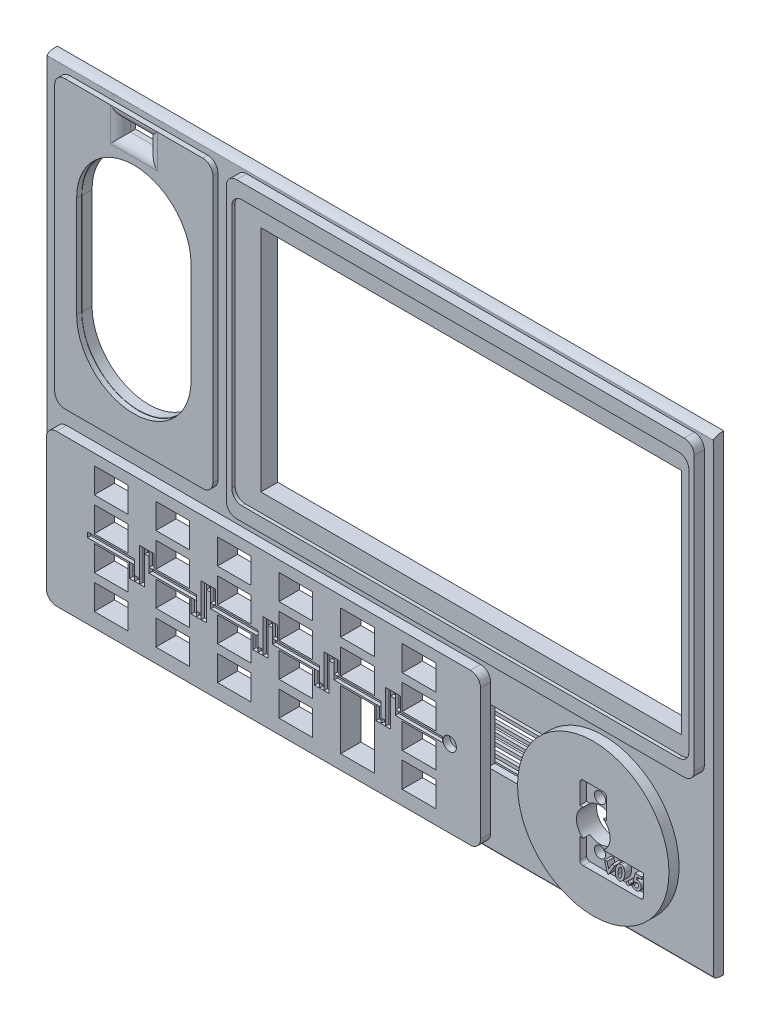
from build123d import *

# Parameters (mm, degrees)
SKETCH1_W                   = 198
SKETCH1_H                   = 140
MAIN_BODY_DEPTH             = 3
LONG_CORNERS_SIZE           = 3
LONG_CORNERS_SIZE_2         = 1
SKETCH2_W                   = 47
SKETCH2_H                   = 85
SPEAKER_DEPTH               = 1.5
SPEAKER_CORNERS_R           = 3
SPEAKER_CUT_DEPTH           = 122.331158548
SKETCH21_W                  = 43
SKETCH21_H                  = 72
SPEAKER_SLOT_DEPTH          = 3
SKETCH36_W                  = 43
SKETCH36_H                  = 0.5
SKETCH36_W_2                = 5.5
SKETCH36_W_3                = 3.5
SKETCH36_W_4                = 10
SPEAKER_PRINT_SUPPORT_DEPTH = 3
SKETCH3_W                   = 139
SKETCH3_H                   = 87.25
LCD_DEPTH                   = 3
LCD_CORNERS_R               = 3
SKETCH9_W                   = 135.8
SKETCH9_H                   = 78.75
LCD_FRONT_DEPTH             = 1
LCD_FRONT_CORNERS_R         = 3
SKETCH10_W                  = 125
SKETCH10_H                  = 68
LCD_BACK_DEPTH              = 122.396046203
SKETCH4_W                   = 129
SKETCH4_H                   = 45
KEYPAD_DEPTH                = 3
KEYPAD_CORNERS_R            = 3
SKETCH25_W                  = 10
SKETCH25_H                  = 7.5
SKETCH25_H_2                = 17.5
KEYPAD_CUTS_0_8_DEPTH       = 122.396046208
SKETCH5_R                   = 22.5
VFO_DEPTH                   = 3
SKETCH7_R                   = 5
VFO_ENCODER_KNOB_CUT_DEPTH  = 122.396046208
SKETCH37_W                  = 19
SKETCH37_H                  = 7
SKETCH37_W_2                = 8
LOGO_CUT_DEPTH              = 2
LOGO_TXT_VER_DEPTH          = 2
LOGO_CORNERS_R              = 1
ESP32_W                     = 18.5
ESP32_H                     = 16.5
ESP32_CAN_CUT_DEPTH         = 3
SKETCH43_W                  = 16.5
SKETCH43_H                  = 16.5
LORA_CUT_DEPTH              = 2.5
SKETCH44_R                  = 1.65
ENCODER_MOUNT_HOLES_DEPTH   = 122.396046208
SKETCH47_W                  = 27
SKETCH47_H                  = 18.5
ESP32_EX_CUT_DEPTH          = 1
SKETCH49_W                  = 8
SKETCH49_H                  = 4
AMB_SENSOR_DEPTH            = 122.396046208
AMB_CORNERS_R               = 3
SKETCH50_W                  = 14
SKETCH50_H                  = 1.5
SKETCH50_W_2                = 1.5
SKETCH50_H_2                = 4.24
SKETCH50_H_3                = 10
SKETCH50_W_3                = 1.3
SKETCH50_W_4                = 1.45
SKETCH50_W_5                = 1.26
SKETCH50_W_6                = 1.46
LORA_ANT_DEPTH              = 1
SKETCH51_R                  = 0.5
LORA_ANT_PIN_DEPTH          = 122.396046208
SKETCH52_R                  = 2
LORA_ANT_SOLDER_DEPTH       = 2
SKETCH53_W                  = 26.5
SKETCH53_H                  = 1
ESP32_SUPPORT_DEPTH         = 1
SKETCH54_W                  = 15.995889497
SKETCH54_H                  = 0.898645477
SKETCH54_H_2                = 1.168239121
SKETCH54_H_3                = 1.033442299
SKETCH54_W_2                = 15.726295854
SKETCH54_H_4                = 1.078374573
SKETCH54_H_5                = 0.943577751
BOSS_EXTRUDE2_DEPTH         = 2.5


# Some blends are built 0.0001 mm under size
with BuildPart() as part:
    # Sketch1 → main_body (new body)
    with BuildSketch(Plane.XY):
        Rectangle(SKETCH1_W, SKETCH1_H)
    extrude(amount=MAIN_BODY_DEPTH)

    # long_corners
    # an asymmetric fillet: 3, 1 mm, written as the material it takes off along each edge
    with BuildSketch(Plane(origin=(-106.5, 70, 3), x_dir=(0, 0, -1), z_dir=(1, 0, 0)), Plane(origin=(106.5, -70, 3), x_dir=(0, 0, -1), z_dir=(-1, 0, 0))) as long_corners_piece_1:
        with BuildLine():
            Bezier((LONG_CORNERS_SIZE, 0), (0, 0), (0, -LONG_CORNERS_SIZE_2), weights=[1, 0.707106781, 1])
            Line((0, -LONG_CORNERS_SIZE_2), (0, 0))
            Line((0, 0), (LONG_CORNERS_SIZE, 0))
        make_face()
    extrude(amount=213, mode=Mode.SUBTRACT)

    # Sketch2 → speaker (add)
    with BuildSketch(Plane.XY.offset(3)):
        with Locations((-71.75, 24.75)):
            Rectangle(SKETCH2_W, SKETCH2_H)
    extrude(amount=SPEAKER_DEPTH)

    # speaker_corners
    speaker_corners_edges = [part.edges().sort_by_distance(p)[0] for p in [
        (-95.25, 67.25, 3.75),
        (-95.25, -17.75, 3.75),
        (-48.25, -17.75, 3.75),
        (-48.25, 67.25, 3.75),
    ]]
    fillet(speaker_corners_edges, radius=SPEAKER_CORNERS_R)

    # Sketch19 → speaker_cut (cut, through all)
    with BuildSketch(Plane.XY.offset(4.5)):
        with BuildLine():
            Line((-88.75, 8.25), (-88.75, 38.25))
            ThreePointArc((-88.75, 38.25), (-71.75, 55.25), (-54.75, 38.25))
            Line((-54.75, 38.25), (-54.75, 8.25))
            ThreePointArc((-54.75, 8.25), (-71.75, -8.75), (-88.75, 8.25))
        make_face()
    extrude(amount=-SPEAKER_CUT_DEPTH, mode=Mode.SUBTRACT)

    # Sketch21 → speaker_slot (cut)
    with BuildSketch(Plane(origin=(0, 0, 0), x_dir=(-1, 0, 0), z_dir=(0, 0, -1))):
        with Locations((71.75, 23.25)):
            Rectangle(SKETCH21_W, SKETCH21_H)
    extrude(amount=-SPEAKER_SLOT_DEPTH, mode=Mode.SUBTRACT)

    # Sketch36 → speaker_print_support (add)
    # profile 1 of 17: a face of its own
    with BuildSketch(Plane(origin=(0, 0, 3), x_dir=(-1, 0, 0), z_dir=(0, 0, -1))):
        with BuildLine():
            Line((54.25, 8.263862744), (54.25, 38.236137256))
            ThreePointArc((54.25, 38.236137256), (71.75, 55.736137256), (89.25, 38.236137256))
            Line((89.25, 38.236137256), (89.25, 8.263862744))
            ThreePointArc((89.25, 8.263862744), (71.75, -9.236137256), (54.25, 8.263862744))
        make_face()
        with BuildLine():
            Line((54.831583339, 8.263862744), (54.831583339, 38.236137256))
            ThreePointArc((54.831583339, 38.236137256), (71.75, 55.154553916), (88.668416661, 38.236137256))
            Line((88.668416661, 38.236137256), (88.668416661, 8.263862744))
            ThreePointArc((88.668416661, 8.263862744), (71.75, -8.654553916), (54.831583339, 8.263862744))
        make_face(mode=Mode.SUBTRACT)
    # profile 2 of 17: a face of its own
    with BuildSketch(Plane(origin=(0, 0, 3), x_dir=(-1, 0, 0), z_dir=(0, 0, -1))):
        with Locations((71.75, 57)):
            Rectangle(SKETCH36_W, SKETCH36_H)
    # profile 3 of 17: a face of its own
    with BuildSketch(Plane(origin=(0, 0, 3), x_dir=(-1, 0, 0), z_dir=(0, 0, -1))):
        with Locations((90.5, 0)):
            Rectangle(SKETCH36_W_2, SKETCH36_H)
    # profile 4 of 17: a face of its own
    with BuildSketch(Plane(origin=(0, 0, 3), x_dir=(-1, 0, 0), z_dir=(0, 0, -1))):
        with Locations((71.75, -10.5)):
            Rectangle(SKETCH36_W, SKETCH36_H)
    # profile 5 of 17: a face of its own
    with BuildSketch(Plane(origin=(0, 0, 3), x_dir=(-1, 0, 0), z_dir=(0, 0, -1))):
        with Locations((90.5, 46.5)):
            Rectangle(SKETCH36_W_2, SKETCH36_H)
    # profile 6 of 17: a face of its own
    with BuildSketch(Plane(origin=(0, 0, 3), x_dir=(-1, 0, 0), z_dir=(0, 0, -1))):
        with Locations((91.5, 35)):
            Rectangle(SKETCH36_W_3, SKETCH36_H)
    # profile 7 of 17: a face of its own
    with BuildSketch(Plane(origin=(0, 0, 3), x_dir=(-1, 0, 0), z_dir=(0, 0, -1))):
        with Locations((91.5, 23.5)):
            Rectangle(SKETCH36_W_3, SKETCH36_H)
    # profile 8 of 17: a face of its own
    with BuildSketch(Plane(origin=(0, 0, 3), x_dir=(-1, 0, 0), z_dir=(0, 0, -1))):
        with Locations((91.5, 11)):
            Rectangle(SKETCH36_W_3, SKETCH36_H)
    # profile 9 of 17: a face of its own
    with BuildSketch(Plane(origin=(0, 0, 3), x_dir=(-1, 0, 0), z_dir=(0, 0, -1))):
        with Locations((88.25, -5.5)):
            Rectangle(SKETCH36_W_4, SKETCH36_H)
    # profile 10 of 17: a face of its own
    with BuildSketch(Plane(origin=(0, 0, 3), x_dir=(-1, 0, 0), z_dir=(0, 0, -1))):
        with Locations((88.25, 52)):
            Rectangle(SKETCH36_W_4, SKETCH36_H)
    # profile 11 of 17: a face of its own
    with BuildSketch(Plane(origin=(0, 0, 3), x_dir=(-1, 0, 0), z_dir=(0, 0, -1))):
        with Locations((55.25, 52)):
            Rectangle(SKETCH36_W_4, SKETCH36_H)
    # profile 12 of 17: a face of its own
    with BuildSketch(Plane(origin=(0, 0, 3), x_dir=(-1, 0, 0), z_dir=(0, 0, -1))):
        with Locations((53, 46.5)):
            Rectangle(SKETCH36_W_2, SKETCH36_H)
    # profile 13 of 17: a face of its own
    with BuildSketch(Plane(origin=(0, 0, 3), x_dir=(-1, 0, 0), z_dir=(0, 0, -1))):
        with Locations((52, 35)):
            Rectangle(SKETCH36_W_3, SKETCH36_H)
    # profile 14 of 17: a face of its own
    with BuildSketch(Plane(origin=(0, 0, 3), x_dir=(-1, 0, 0), z_dir=(0, 0, -1))):
        with Locations((52, 23.5)):
            Rectangle(SKETCH36_W_3, SKETCH36_H)
    # profile 15 of 17: a face of its own
    with BuildSketch(Plane(origin=(0, 0, 3), x_dir=(-1, 0, 0), z_dir=(0, 0, -1))):
        with Locations((52, 10.5)):
            Rectangle(SKETCH36_W_3, SKETCH36_H)
    # profile 16 of 17: a face of its own
    with BuildSketch(Plane(origin=(0, 0, 3), x_dir=(-1, 0, 0), z_dir=(0, 0, -1))):
        with Locations((53, 0)):
            Rectangle(SKETCH36_W_2, SKETCH36_H)
    # profile 17 of 17: a face of its own
    with BuildSketch(Plane(origin=(0, 0, 3), x_dir=(-1, 0, 0), z_dir=(0, 0, -1))):
        with Locations((55.25, -5.5)):
            Rectangle(SKETCH36_W_4, SKETCH36_H)
    extrude(amount=SPEAKER_PRINT_SUPPORT_DEPTH)

    # Sketch3 → lcd (add)
    with BuildSketch(Plane.XY.offset(3)):
        with Locations((26.75, 24.625)):
            Rectangle(SKETCH3_W, SKETCH3_H)
    extrude(amount=LCD_DEPTH)

    # lcd_corners
    lcd_corners_edges = [part.edges().sort_by_distance(p)[0] for p in [
        (-42.75, 68.25, 4.5),
        (-42.75, -19, 4.5),
        (96.25, -19, 4.5),
        (96.25, 68.25, 4.5),
    ]]
    fillet(lcd_corners_edges, radius=LCD_CORNERS_R)

    # Sketch9 → lcd_front (cut)
    with BuildSketch(Plane.XY.offset(6)):
        with Locations((26.75, 24.5)):
            Rectangle(SKETCH9_W, SKETCH9_H)
    extrude(amount=-LCD_FRONT_DEPTH, mode=Mode.SUBTRACT)

    # lcd_front_corners
    lcd_front_corners_edges = [part.edges().sort_by_distance(p)[0] for p in [
        (-41.15, -14.875, 5.5),
        (-41.15, 63.875, 5.5),
        (94.65, 63.875, 5.5),
        (94.65, -14.875, 5.5),
    ]]
    fillet(lcd_front_corners_edges, radius=LCD_FRONT_CORNERS_R)

    # Sketch10 → lcd_back (cut, through all)
    with BuildSketch(Plane(origin=(0, 0, 0), x_dir=(-1, 0, 0), z_dir=(0, 0, -1))):
        with Locations((-29, 24.5)):
            Rectangle(SKETCH10_W, SKETCH10_H)
    extrude(amount=-LCD_BACK_DEPTH, mode=Mode.SUBTRACT)

    # Sketch4 → keypad (add)
    with BuildSketch(Plane.XY.offset(3)):
        with Locations((-31.75, -45.75)):
            Rectangle(SKETCH4_W, SKETCH4_H)
    extrude(amount=KEYPAD_DEPTH)

    # keypad_corners
    keypad_corners_edges = [part.edges().sort_by_distance(p)[0] for p in [
        (-96.25, -23.25, 4.5),
        (-96.25, -68.25, 4.5),
        (32.75, -68.25, 4.5),
        (32.75, -23.25, 4.5),
    ]]
    fillet(keypad_corners_edges, radius=KEYPAD_CORNERS_R)

    # Sketch25 → keypad_cuts_0.8 (cut, through all)
    with BuildSketch(Plane.XY.offset(6)):
        with Locations((-77, -30.25)):
            Rectangle(SKETCH25_W, SKETCH25_H)
        with Locations((-77, -40.25)):
            Rectangle(SKETCH25_W, SKETCH25_H)
        with Locations((-77, -50.25)):
            Rectangle(SKETCH25_W, SKETCH25_H)
        with Locations((-77, -60.25)):
            Rectangle(SKETCH25_W, SKETCH25_H)
        with Locations((-58.7, -30.25)):
            Rectangle(SKETCH25_W, SKETCH25_H)
        with Locations((-58.7, -40.25)):
            Rectangle(SKETCH25_W, SKETCH25_H)
        with Locations((-58.7, -50.25)):
            Rectangle(SKETCH25_W, SKETCH25_H)
        with Locations((-58.7, -60.25)):
            Rectangle(SKETCH25_W, SKETCH25_H)
        with Locations((-40.4, -30.25)):
            Rectangle(SKETCH25_W, SKETCH25_H)
        with Locations((-40.4, -40.25)):
            Rectangle(SKETCH25_W, SKETCH25_H)
        with Locations((-40.4, -50.25)):
            Rectangle(SKETCH25_W, SKETCH25_H)
        with Locations((-40.4, -60.25)):
            Rectangle(SKETCH25_W, SKETCH25_H)
        with Locations((-22.1, -30.25)):
            Rectangle(SKETCH25_W, SKETCH25_H)
        with Locations((-22.1, -40.25)):
            Rectangle(SKETCH25_W, SKETCH25_H)
        with Locations((-22.1, -50.25)):
            Rectangle(SKETCH25_W, SKETCH25_H)
        with Locations((-22.1, -60.25)):
            Rectangle(SKETCH25_W, SKETCH25_H)
        with Locations((-3.8, -30.25)):
            Rectangle(SKETCH25_W, SKETCH25_H)
        with Locations((14.5, -30.25)):
            Rectangle(SKETCH25_W, SKETCH25_H)
        with Locations((-3.8, -40.25)):
            Rectangle(SKETCH25_W, SKETCH25_H)
        with Locations((14.5, -40.25)):
            Rectangle(SKETCH25_W, SKETCH25_H)
        with Locations((14.5, -50.25)):
            Rectangle(SKETCH25_W, SKETCH25_H)
        with Locations((14.5, -60.25)):
            Rectangle(SKETCH25_W, SKETCH25_H)
        with Locations((-3.8, -55.25)):
            Rectangle(SKETCH25_W, SKETCH25_H_2)
    extrude(amount=-KEYPAD_CUTS_0_8_DEPTH, mode=Mode.SUBTRACT)

    # Sketch5 → vfo (add)
    with BuildSketch(Plane.XY.offset(3)):
        with Locations((66.25, -45.75)):
            Circle(SKETCH5_R)
    extrude(amount=VFO_DEPTH)

    # Sketch7 → vfo_encoder_knob_cut (cut, through all)
    with BuildSketch(Plane.XY.offset(6)):
        with Locations((66.25, -45.75)):
            Circle(SKETCH7_R)
    extrude(amount=-VFO_ENCODER_KNOB_CUT_DEPTH, mode=Mode.SUBTRACT)

    # Sketch37 → logo_cut (cut)
    with BuildSketch(Plane.XY.offset(6)):
        with Locations((71.75, -53.25)):
            Rectangle(SKETCH37_W, SKETCH37_H)
        with Locations((66.25, -38.25)):
            Rectangle(SKETCH37_W_2, SKETCH37_H)
    extrude(amount=-LOGO_CUT_DEPTH, mode=Mode.SUBTRACT)

    # Sketch39 → logo_txt_ver (add)
    # profile 1 of 4: a face of its own
    with BuildSketch(Plane.XY.offset(4)):
        Polygon((69.593603098, -52.1228561), (70.325447382, -52.1228561), (70.816452991, -53.843495791), (71.823904915, -52.1228561), (72.632071314, -52.1228561), (70.821541132, -55.216445844), (70.476395566, -55.216445844), align=None)
    # profile 2 of 4: a face of its own
    with BuildSketch(Plane.XY.offset(4)):
        with BuildLine():
            add(Edge.make_bspline(
                [(74.483306624, -50.874565502), (74.52298082, -50.875795528), (74.601170322, -50.87821965), (74.715492643, -50.899653781), (74.825349181, -50.932120481), (74.92921693, -50.980946205), (75.029477781, -51.040750753), (75.122711711, -51.116943912), (75.212332831, -51.204521963), (75.296047107, -51.305539519), (75.372824655, -51.419248323), (75.438649142, -51.546769094), (75.49569148, -51.685939906), (75.540969256, -51.83776318), (75.576664195, -52.001610164), (75.60145224, -52.177923197), (75.616969224, -52.366525273), (75.618744605, -52.496237412), (75.61965812, -52.562980299)],
                knots=[0, 0, 0, 0, 0.836471817, 1.648510141, 2.446693269, 3.247435573, 4.063800371, 4.904091908, 5.781463953, 6.704836402, 7.667709944, 8.670923685, 9.727683881, 10.837250621, 12.009625467, 13.263198326, 14.591789123, 16, 16, 16, 16], degree=3))
            add(Edge.make_bspline(
                [(75.61965812, -52.562980299), (75.618789956, -52.632816793), (75.617076972, -52.770612041), (75.605096765, -52.974626446), (75.584904009, -53.17299239), (75.556211827, -53.365747486), (75.518683541, -53.552428277), (75.473940108, -53.733689305), (75.420453316, -53.909101426), (75.359593818, -54.077949378), (75.293364906, -54.237978695), (75.221962721, -54.387157738), (75.146403231, -54.524126464), (75.06893028, -54.650882727), (74.985482248, -54.764128364), (74.899617931, -54.866890365), (74.810118692, -54.958236021), (74.715135486, -55.036206727), (74.618399212, -55.10398037), (74.520168842, -55.163147091), (74.420182228, -55.213287094), (74.31810111, -55.254294613), (74.214386359, -55.285440783), (74.109326621, -55.308813247), (74.002290106, -55.32272783), (73.930152573, -55.324235706), (73.893930288, -55.324992853)],
                knots=[0, 0, 0, 0, 1.396844559, 2.756131219, 4.086127259, 5.383920942, 6.652453196, 7.89349539, 9.116895717, 10.318757433, 11.482194025, 12.579741648, 13.624829685, 14.610133714, 15.548779577, 16.435605836, 17.287197802, 18.102347136, 18.889788549, 19.648068299, 20.394000194, 21.124756219, 21.84557971, 22.557590164, 23.275725456, 24, 24, 24, 24], degree=3))
            add(Edge.make_bspline(
                [(73.893930288, -55.324992853), (73.843149178, -55.322924604), (73.743631944, -55.318871396), (73.598486378, -55.285253638), (73.461942844, -55.230862228), (73.356167713, -55.167459275), (73.277034517, -55.106688798), (73.220792965, -55.054616575), (73.16575177, -54.99905032), (73.11577994, -54.936249232), (73.068747172, -54.868509996), (73.023164401, -54.796241041), (72.981949214, -54.71810344), (72.943694527, -54.634613014), (72.908425992, -54.545461253), (72.879274748, -54.44916121), (72.85345146, -54.346525614), (72.834063845, -54.236997381), (72.816126012, -54.121516974), (72.806048605, -53.999107415), (72.798956368, -53.870434257), (72.797950069, -53.782449115), (72.797435897, -53.737492853)],
                knots=[0, 0, 0, 0, 1.406247179, 2.755863859, 4.106117258, 5.46602111, 6.158742467, 6.868709005, 7.589063128, 8.324514997, 9.089670002, 9.87455016, 10.69128516, 11.536247762, 12.419471489, 13.346380782, 14.323181077, 15.351303999, 16.428392134, 17.561291642, 18.753934945, 20, 20, 20, 20], degree=3))
            add(Edge.make_bspline(
                [(72.797435897, -53.737492853), (72.798307308, -53.661438712), (72.800028518, -53.511216666), (72.811964663, -53.289128668), (72.832071426, -53.073513255), (72.861158062, -52.864791305), (72.897133299, -52.662605135), (72.942507727, -52.467515455), (72.994355699, -52.278411135), (73.036754183, -52.156281873), (73.057779113, -52.095719348)],
                knots=[0, 0, 0, 0, 1.092573637, 2.158050095, 3.194115651, 4.202596009, 5.184740479, 6.143227219, 7.07924729, 8, 8, 8, 8], degree=3))
            add(Edge.make_bspline(
                [(73.057779113, -52.095719348), (73.077537426, -52.044588755), (73.116173308, -51.944606759), (73.182812761, -51.802210754), (73.252759666, -51.669700483), (73.327413864, -51.548078362), (73.406479988, -51.437046775), (73.490337998, -51.336877263), (73.578946044, -51.247029176), (73.67217263, -51.168382345), (73.768570642, -51.099815011), (73.865727515, -51.038904109), (73.96573894, -50.989012823), (74.066482923, -50.947174616), (74.168613651, -50.914684142), (74.272229962, -50.891943052), (74.377124819, -50.876571566), (74.447918341, -50.875234083), (74.483306624, -50.874565502)],
                knots=[0, 0, 0, 0, 1.312439913, 2.566376662, 3.7626465, 4.899353607, 5.981447343, 7.024199363, 8.024692673, 8.999854102, 9.941079975, 10.856034809, 11.7431154, 12.614348406, 13.466487218, 14.305782657, 15.153094213, 16, 16, 16, 16], degree=3))
        make_face()
        with BuildLine():
            add(Edge.make_bspline(
                [(74.404440438, -51.580121058), (74.376778708, -51.581929582), (74.320887807, -51.585583729), (74.239664339, -51.615644306), (74.161652517, -51.663287994), (74.116194557, -51.706646732), (74.092367788, -51.729373194)],
                knots=[0, 0, 0, 0, 0.932167559, 1.883457255, 2.89061511, 4, 4, 4, 4], degree=3))
            add(Edge.make_bspline(
                [(74.092367788, -51.729373194), (74.074648352, -51.749355338), (74.03734554, -51.791421579), (73.988622227, -51.865349436), (73.938519059, -51.948386496), (73.892783823, -52.044104492), (73.847049082, -52.1502047), (73.801664185, -52.267294971), (73.76032745, -52.396275902), (73.704202078, -52.581971795), (73.645383273, -52.824621628), (73.594485412, -53.123512938), (73.56305768, -53.428137047), (73.559203645, -53.633394549), (73.557264957, -53.736644829)],
                knots=[0, 0, 0, 0, 0.454841493, 0.957528522, 1.506411314, 2.107825232, 2.764136245, 3.476658851, 4.247912131, 5.07291354, 6.784378205, 8.500722671, 10.239765365, 12, 12, 12, 12], degree=3))
            add(Edge.make_bspline(
                [(73.557264957, -53.736644829), (73.557601345, -53.777917397), (73.558246753, -53.857104665), (73.562797234, -53.970602004), (73.572723703, -54.073751147), (73.58360441, -54.166784338), (73.599681824, -54.24923044), (73.619208766, -54.321233266), (73.641333582, -54.383256201), (73.668264815, -54.435457592), (73.698096775, -54.479199696), (73.731243169, -54.516371399), (73.766094212, -54.548536662), (73.804514421, -54.574472182), (73.84478695, -54.595165812), (73.888565479, -54.608248033), (73.934154819, -54.618577069), (73.965948672, -54.619147217), (73.982124733, -54.619437297)],
                knots=[0, 0, 0, 0, 1.809169144, 3.47114723, 4.976568932, 6.350508084, 7.575216927, 8.654321082, 9.618705548, 10.455493865, 11.22189838, 11.932917759, 12.63470061, 13.29454068, 13.959479695, 14.609946561, 15.292769288, 16, 16, 16, 16], degree=3))
            add(Edge.make_bspline(
                [(73.982124733, -54.619437297), (74.012692304, -54.617003318), (74.07608428, -54.611955657), (74.169989406, -54.572799356), (74.263226826, -54.510978012), (74.340457582, -54.442723851), (74.402399265, -54.374102607), (74.447576899, -54.307929108), (74.492488631, -54.230956457), (74.537550245, -54.143276893), (74.579293974, -54.042951999), (74.621885377, -53.931968516), (74.663183308, -53.80918437), (74.716607233, -53.628734273), (74.775431522, -53.389278435), (74.823607381, -53.088086267), (74.854093568, -52.773919376), (74.85789457, -52.559942837), (74.85982906, -52.451041197)],
                knots=[0, 0, 0, 0, 0.585084729, 1.213366824, 1.923217654, 2.726038827, 3.183054462, 3.692969635, 4.259263019, 4.892137045, 5.581993971, 6.3422359, 7.172083011, 8.065836625, 9.951587279, 11.896519821, 13.911566738, 16, 16, 16, 16], degree=3))
            add(Edge.make_bspline(
                [(74.85982906, -52.451041197), (74.859573711, -52.413439706), (74.859079941, -52.340729341), (74.853354196, -52.235989355), (74.84279836, -52.139589901), (74.830319363, -52.051209867), (74.810833655, -51.971703464), (74.790737732, -51.899612323), (74.764122185, -51.836785699), (74.73432591, -51.781608182), (74.701044134, -51.73430589), (74.666414836, -51.692771673), (74.62827255, -51.658652), (74.588704551, -51.629335674), (74.545792755, -51.606961659), (74.500481608, -51.59195471), (74.453195181, -51.582124112), (74.420885169, -51.580796678), (74.404440438, -51.580121058)],
                knots=[0, 0, 0, 0, 1.651300251, 3.193135231, 4.60384893, 5.910135154, 7.108621979, 8.196635245, 9.19265296, 10.098222774, 10.945408105, 11.729089381, 12.467301952, 13.187443458, 13.887068836, 14.581941946, 15.278255209, 16, 16, 16, 16], degree=3))
        make_face(mode=Mode.SUBTRACT)
    # profile 3 of 4: a face of its own
    with BuildSketch(Plane.XY.offset(4)):
        with BuildLine():
            add(Edge.make_bspline(
                [(76.488034188, -54.293796271), (76.52047559, -54.295195466), (76.58430585, -54.29794846), (76.675592646, -54.326730368), (76.760117021, -54.371537446), (76.83407679, -54.4342546), (76.897155306, -54.508334033), (76.943987182, -54.592201885), (76.971114608, -54.685079112), (76.974670268, -54.749291486), (76.976495726, -54.78225781)],
                knots=[0, 0, 0, 0, 1.011829643, 1.990831015, 2.96394547, 3.98733706, 5.003945692, 5.993273531, 6.969756284, 8, 8, 8, 8], degree=3))
            add(Edge.make_bspline(
                [(76.976495726, -54.78225781), (76.974620199, -54.814649503), (76.970936111, -54.878276297), (76.94403317, -54.970657997), (76.896878441, -55.054519863), (76.834434584, -55.129490294), (76.759809835, -55.191830672), (76.676017962, -55.238284814), (76.584064164, -55.265180699), (76.520429757, -55.268850893), (76.488034188, -55.270719348)],
                knots=[0, 0, 0, 0, 1.013694729, 1.991193998, 2.981551723, 4.006008661, 5.030465598, 6.008806002, 6.986305271, 8, 8, 8, 8], degree=3))
            add(Edge.make_bspline(
                [(76.488034188, -55.270719348), (76.455362973, -55.268839785), (76.391187038, -55.265147766), (76.298568031, -55.238486954), (76.214598936, -55.191782119), (76.139951116, -55.129733725), (76.078255891, -55.054464116), (76.032178185, -54.97043986), (76.005085163, -54.878298836), (76.001432288, -54.814657107), (75.99957265, -54.78225781)],
                knots=[0, 0, 0, 0, 1.02155614, 2.006638561, 2.984070978, 4.007577129, 5.025452526, 6.010654007, 6.987246069, 8, 8, 8, 8], degree=3))
            add(Edge.make_bspline(
                [(75.99957265, -54.78225781), (76.001381788, -54.749283713), (76.004905659, -54.685056198), (76.032224273, -54.592419638), (76.07798063, -54.508393961), (76.14030968, -54.434008005), (76.214292162, -54.371587534), (76.298992626, -54.326528348), (76.390946483, -54.297979543), (76.455317207, -54.295205966), (76.488034188, -54.293796271)],
                knots=[0, 0, 0, 0, 1.029295292, 2.004879113, 2.989063463, 3.999073543, 5.021523017, 5.993741641, 6.980301721, 8, 8, 8, 8], degree=3))
        make_face()
    # profile 4 of 4: a face of its own
    with BuildSketch(Plane.XY.offset(4)):
        with BuildLine():
            Line((78.707311699, -50.983112511), (80.667094017, -50.983112511))
            Line((80.667094017, -50.983112511), (80.612820513, -51.688668066))
            Line((80.612820513, -51.688668066), (79.303472222, -51.688668066))
            Line((79.303472222, -51.688668066), (79.025320513, -52.529907382))
            add(Edge.make_bspline(
                [(79.025320513, -52.529907382), (79.055596354, -52.517305169), (79.116166068, -52.492093235), (79.211439858, -52.467456665), (79.308855269, -52.451312621), (79.3746403, -52.449440298), (79.407779113, -52.448497126)],
                knots=[0, 0, 0, 0, 0.998112439, 1.996819346, 2.990909824, 4, 4, 4, 4], degree=3))
            add(Edge.make_bspline(
                [(79.407779113, -52.448497126), (79.445986369, -52.449498722), (79.520701826, -52.451457374), (79.630090901, -52.466093021), (79.73393707, -52.490407704), (79.831869266, -52.525531932), (79.924308801, -52.569598388), (80.010241474, -52.624386248), (80.090695319, -52.688619949), (80.165020121, -52.762130849), (80.232335605, -52.844706469), (80.290998027, -52.935691375), (80.340232065, -53.035109738), (80.381327753, -53.141972101), (80.411070387, -53.257691902), (80.434238272, -53.380555147), (80.447908726, -53.511893062), (80.449289562, -53.602059758), (80.45, -53.648450385)],
                knots=[0, 0, 0, 0, 1.020720285, 1.996049746, 2.943245614, 3.865445419, 4.770849874, 5.674014514, 6.582344456, 7.517049549, 8.461983903, 9.42367584, 10.403295435, 11.421749409, 12.477096939, 13.591170916, 14.760661157, 16, 16, 16, 16], degree=3))
            add(Edge.make_bspline(
                [(80.45, -53.648450385), (80.448665393, -53.709556766), (80.446050935, -53.829262464), (80.426527681, -54.004363793), (80.393344251, -54.170250316), (80.348023746, -54.327683358), (80.287131905, -54.475155884), (80.21525851, -54.614634144), (80.128791005, -54.744358946), (80.029975339, -54.863746477), (79.922313237, -54.972314459), (79.805999564, -55.065846974), (79.6843132, -55.146433443), (79.555634879, -55.21239401), (79.419808592, -55.262007803), (79.27827254, -55.299180148), (79.129977465, -55.320273248), (79.029058907, -55.32340376), (78.977831197, -55.324992853)],
                knots=[0, 0, 0, 0, 1.173543811, 2.298939634, 3.378629864, 4.419763593, 5.440091566, 6.438176937, 7.429014836, 8.427971092, 9.41078854, 10.360474936, 11.289592146, 12.209863076, 13.130646371, 14.061665239, 15.016073429, 16, 16, 16, 16], degree=3))
            add(Edge.make_bspline(
                [(78.977831197, -55.324992853), (78.941343931, -55.324344985), (78.869355306, -55.323066756), (78.762754918, -55.312787436), (78.659336358, -55.295003046), (78.558939718, -55.269980945), (78.461096539, -55.239963799), (78.366593564, -55.201688314), (78.275923202, -55.155203103), (78.187178628, -55.103839928), (78.102599834, -55.044594575), (78.022553197, -54.977710864), (77.946088353, -54.90484994), (77.873855638, -54.824875458), (77.806071462, -54.737828178), (77.741363019, -54.644828966), (77.682009192, -54.544121899), (77.64607092, -54.47377032), (77.627777778, -54.437960267)],
                knots=[0, 0, 0, 0, 1.022859238, 2.018080294, 2.999190336, 3.962207893, 4.917235095, 5.866490093, 6.816373485, 7.771926692, 8.739336783, 9.707395925, 10.693964512, 11.698357727, 12.725720478, 13.785346591, 14.8727068, 16, 16, 16, 16], degree=3))
            Line((77.627777778, -54.437960267), (78.330789263, -54.124191571))
            add(Edge.make_bspline(
                [(78.330789263, -54.124191571), (78.360451583, -54.16813213), (78.416102053, -54.250570483), (78.503014468, -54.360410478), (78.589017158, -54.447114481), (78.673555366, -54.51403534), (78.760065053, -54.561950128), (78.848929038, -54.595265145), (78.941599504, -54.615412534), (79.00458737, -54.618088247), (79.036344818, -54.619437297)],
                knots=[0, 0, 0, 0, 1.407698414, 2.641030095, 3.71326683, 4.644229953, 5.494388505, 6.328183133, 7.157097367, 8, 8, 8, 8], degree=3))
            add(Edge.make_bspline(
                [(79.036344818, -54.619437297), (79.059290755, -54.618883166), (79.104610303, -54.617788725), (79.171108865, -54.606133944), (79.234845671, -54.588508749), (79.295733019, -54.563917172), (79.352692967, -54.531242039), (79.406839431, -54.491816071), (79.457499082, -54.444696511), (79.505853969, -54.391856675), (79.548831726, -54.332119365), (79.58728318, -54.268017205), (79.618518327, -54.19831001), (79.644878691, -54.124661406), (79.665362463, -54.046054062), (79.679159354, -53.962869348), (79.689310856, -53.875120096), (79.689879383, -53.814977176), (79.69017094, -53.784134145)],
                knots=[0, 0, 0, 0, 0.927075282, 1.831027126, 2.721359743, 3.598085148, 4.478603181, 5.370329063, 6.300781167, 7.271983059, 8.262041119, 9.271703604, 10.289679922, 11.345465186, 12.432354444, 13.569366541, 14.753500788, 16, 16, 16, 16], degree=3))
            add(Edge.make_bspline(
                [(79.69017094, -53.784134145), (79.688685582, -53.739060949), (79.685837947, -53.652649438), (79.660296461, -53.529561132), (79.617127939, -53.420110594), (79.556758997, -53.32675985), (79.485115635, -53.250905898), (79.405003729, -53.194666702), (79.316268199, -53.160257558), (79.254298937, -53.156138889), (79.222909989, -53.154052682)],
                knots=[0, 0, 0, 0, 1.239981349, 2.377214621, 3.442410989, 4.461421974, 5.419299017, 6.29797895, 7.137884662, 8, 8, 8, 8], degree=3))
            add(Edge.make_bspline(
                [(79.222909989, -53.154052682), (79.201669527, -53.154954268), (79.159702329, -53.156735633), (79.097957109, -53.168303753), (79.040308693, -53.190415666), (78.984751008, -53.218086239), (78.934019595, -53.25623752), (78.886050506, -53.301825624), (78.840737518, -53.355367222), (78.814824415, -53.395971175), (78.801442308, -53.416939968)],
                knots=[0, 0, 0, 0, 0.978206346, 1.932753505, 2.875607702, 3.812696253, 4.78098368, 5.784402359, 6.855815662, 8, 8, 8, 8], degree=3))
            Line((78.801442308, -53.416939968), (78.116239316, -53.213414327))
            Line((78.116239316, -53.213414327), (78.707311699, -50.983112511))
        make_face()
    extrude(amount=LOGO_TXT_VER_DEPTH)

    # logo_corners
    logo_corners_edges = [part.edges().sort_by_distance(p)[0] for p in [
        (62.25, -56.75, 5),
        (81.25, -56.75, 5),
        (62.25, -34.75, 5),
        (70.25, -34.75, 5),
    ]]
    fillet(logo_corners_edges, radius=LOGO_CORNERS_R)

    # esp32 → esp32_can_cut (cut)
    with BuildSketch(Plane(origin=(0, 0, 0), x_dir=(-1, 0, 0), z_dir=(0, 0, -1))):
        with Locations((-41.25, -40.3)):
            Rectangle(ESP32_W, ESP32_H)
    extrude(amount=-ESP32_CAN_CUT_DEPTH, mode=Mode.SUBTRACT)

    # Sketch43 → lora_cut (cut)
    with BuildSketch(Plane(origin=(0, 0, 0), x_dir=(-1, 0, 0), z_dir=(0, 0, -1))):
        with Locations((-42.25, -58.75)):
            Rectangle(SKETCH43_W, SKETCH43_H)
    extrude(amount=-LORA_CUT_DEPTH, mode=Mode.SUBTRACT)

    # Sketch44 → encoder_mount_holes (cut, through all)
    with BuildSketch(Plane.XY.offset(6)):
        with Locations((66.25, -38.75)):
            Circle(SKETCH44_R)
        with Locations((66.25, -52.75)):
            Circle(SKETCH44_R)
    extrude(amount=-ENCODER_MOUNT_HOLES_DEPTH, mode=Mode.SUBTRACT)

    # Sketch47 → esp32_ex_cut (cut)
    with BuildSketch(Plane(origin=(0, 0, 0), x_dir=(-1, 0, 0), z_dir=(0, 0, -1))):
        with Locations((-44.5, -40.3)):
            Rectangle(SKETCH47_W, SKETCH47_H)
    extrude(amount=-ESP32_EX_CUT_DEPTH, mode=Mode.SUBTRACT)

    # Sketch49 → amb_sensor (cut, through all)
    with BuildSketch(Plane(origin=(0, 0, 0), x_dir=(-1, 0, 0), z_dir=(0, 0, -1))):
        with Locations((71.75, 62.25)):
            Rectangle(SKETCH49_W, SKETCH49_H)
    extrude(amount=-AMB_SENSOR_DEPTH, mode=Mode.SUBTRACT)

    # amb_corners
    amb_corners_edges = [part.edges().sort_by_distance(p)[0] for p in [
        (-71.75, 60.25, 4.5),
        (-75.75, 62.25, 4.5),
        (-71.75, 64.25, 4.5),
        (-67.75, 62.25, 4.5),
    ]]
    fillet(amb_corners_edges, radius=AMB_CORNERS_R - 0.0001)  # a hair under: the kernel refuses the full size

    # Sketch50 → lora_ant (cut)
    with BuildSketch(Plane.XY.offset(6)):
        with Locations((-77, -45.25)):
            Rectangle(SKETCH50_W, SKETCH50_H)
        with Locations((-58.7, -45.25)):
            Rectangle(SKETCH50_W, SKETCH50_H)
        with Locations((-40.4, -45.25)):
            Rectangle(SKETCH50_W, SKETCH50_H)
        with Locations((-22.1, -45.25)):
            Rectangle(SKETCH50_W, SKETCH50_H)
        with Locations((-3.8, -45.25)):
            Rectangle(SKETCH50_W, SKETCH50_H)
        with Locations((14.5, -45.25)):
            Rectangle(SKETCH50_W, SKETCH50_H)
        with Locations((8.24, -42.37)):
            Rectangle(SKETCH50_W_2, SKETCH50_H_2)
        with Locations((2.45, -48.13)):
            Rectangle(SKETCH50_W_2, SKETCH50_H_2)
        with Locations((5.27, -45.25)):
            Rectangle(SKETCH50_W_2, SKETCH50_H_3)
        with Locations((3.86, -49.5)):
            Rectangle(SKETCH50_W_3, SKETCH50_H)
        with Locations((6.755, -41)):
            Rectangle(SKETCH50_W_4, SKETCH50_H)
        with Locations((-13.03, -45.25)):
            Rectangle(SKETCH50_W_2, SKETCH50_H_3)
        with Locations((-31.13, -45.25)):
            Rectangle(SKETCH50_W_2, SKETCH50_H_3)
        with Locations((-49.48, -45.25)):
            Rectangle(SKETCH50_W_2, SKETCH50_H_3)
        with Locations((-67.78, -45.25)):
            Rectangle(SKETCH50_W_2, SKETCH50_H_3)
        with Locations((-70.75, -48.13)):
            Rectangle(SKETCH50_W_2, SKETCH50_H_2)
        with Locations((-69.265, -49.5)):
            Rectangle(SKETCH50_W_4, SKETCH50_H)
        with Locations((-66.37, -41)):
            Rectangle(SKETCH50_W_3, SKETCH50_H)
        with Locations((-64.96, -42.37)):
            Rectangle(SKETCH50_W_2, SKETCH50_H_2)
        with Locations((-52.45, -48.13)):
            Rectangle(SKETCH50_W_2, SKETCH50_H_2)
        with Locations((-50.965, -49.5)):
            Rectangle(SKETCH50_W_4, SKETCH50_H)
        with Locations((-48.07, -41)):
            Rectangle(SKETCH50_W_3, SKETCH50_H)
        with Locations((-46.66, -42.37)):
            Rectangle(SKETCH50_W_2, SKETCH50_H_2)
        with Locations((-34.15, -48.13)):
            Rectangle(SKETCH50_W_2, SKETCH50_H_2)
        with Locations((-32.64, -49.5)):
            Rectangle(SKETCH50_W_2, SKETCH50_H)
        with Locations((-29.74, -41)):
            Rectangle(SKETCH50_W_5, SKETCH50_H)
        with Locations((-28.35, -42.37)):
            Rectangle(SKETCH50_W_2, SKETCH50_H_2)
        with Locations((-15.85, -48.13)):
            Rectangle(SKETCH50_W_2, SKETCH50_H_2)
        with Locations((-14.44, -49.5)):
            Rectangle(SKETCH50_W_3, SKETCH50_H)
        with Locations((-11.54, -41)):
            Rectangle(SKETCH50_W_6, SKETCH50_H)
        with Locations((-10.05, -42.37)):
            Rectangle(SKETCH50_W_2, SKETCH50_H_2)
    extrude(amount=-LORA_ANT_DEPTH, mode=Mode.SUBTRACT)

    # Sketch51 → lora_ant_pin (cut, through all)
    with BuildSketch(Plane.XY.offset(6)):
        with Locations((23.6, -45.25)):
            Circle(SKETCH51_R)
    extrude(amount=-LORA_ANT_PIN_DEPTH, mode=Mode.SUBTRACT)

    # Sketch52 → lora_ant_solder (cut)
    with BuildSketch(Plane.XY.offset(6)):
        with Locations((23.6, -45.25)):
            Circle(SKETCH52_R)
    extrude(amount=-LORA_ANT_SOLDER_DEPTH, mode=Mode.SUBTRACT)

    # Sketch53 → esp32_support (add)
    with BuildSketch(Plane(origin=(0, 0, 1), x_dir=(-1, 0, 0), z_dir=(0, 0, -1))):
        with Locations((-44.581142086, -32.05)):
            Rectangle(SKETCH53_W, SKETCH53_H)
        with Locations((-44.581142086, -35.55)):
            Rectangle(SKETCH53_W, SKETCH53_H)
        with Locations((-44.581142086, -38.55)):
            Rectangle(SKETCH53_W, SKETCH53_H)
        with Locations((-44.581142086, -41.05)):
            Rectangle(SKETCH53_W, SKETCH53_H)
        with Locations((-44.581142086, -43.55)):
            Rectangle(SKETCH53_W, SKETCH53_H)
        with Locations((-44.581142086, -46.55)):
            Rectangle(SKETCH53_W, SKETCH53_H)
        with Locations((-44.581142086, -48.55)):
            Rectangle(SKETCH53_W, SKETCH53_H)
    extrude(amount=ESP32_SUPPORT_DEPTH)

    # Sketch54 → Boss-Extrude2 (add)
    with BuildSketch(Plane(origin=(0, 0, 2.5), x_dir=(-1, 0, 0), z_dir=(0, 0, -1))):
        with Locations((-42.289336357, -51.899517528)):
            Rectangle(SKETCH54_W, SKETCH54_H)
        with Locations((-42.289336357, -59.807597729)):
            Rectangle(SKETCH54_W, SKETCH54_H_2)
        with Locations((-42.289336357, -65.356733551)):
            Rectangle(SKETCH54_W, SKETCH54_H_3)
        with Locations((-42.154539535, -55.763693081)):
            Rectangle(SKETCH54_W_2, SKETCH54_H_4)
        with Locations((-42.154539535, -62.705729394)):
            Rectangle(SKETCH54_W_2, SKETCH54_H_5)
    extrude(amount=BOSS_EXTRUDE2_DEPTH)


solid = part.part
